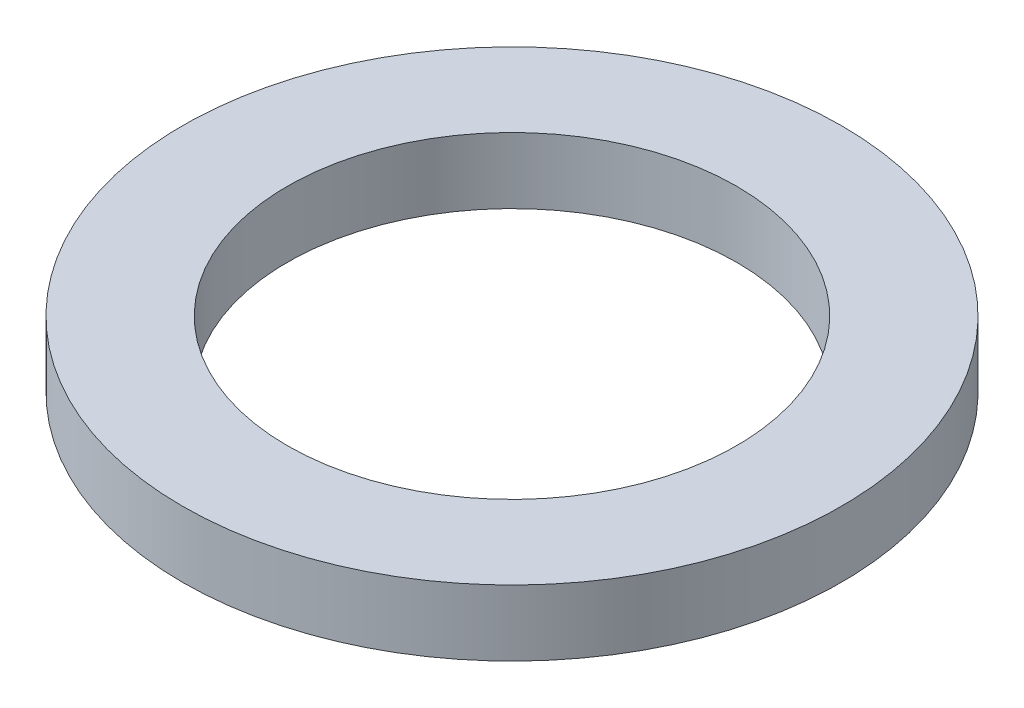
from build123d import *

# Parameters (mm, degrees)
SKETCH1_R           = 55
BOSS_EXTRUDE1_DEPTH = 11
SKETCH2_R           = 37.5
CUT_EXTRUDE1_DEPTH  = 79.555712714


with BuildPart() as part:
    # Sketch1 → Boss-Extrude1 (new body)
    with BuildSketch(Plane(origin=(0, 0, 0), x_dir=(1, 0, 0), z_dir=(0, 1, 0))):
        Circle(SKETCH1_R)
    extrude(amount=BOSS_EXTRUDE1_DEPTH)

    # Sketch2 → Cut-Extrude1 (cut, through all)
    with BuildSketch(Plane(origin=(0, 0, 0), x_dir=(1, 0, 0), z_dir=(0, 1, 0))):
        Circle(SKETCH2_R)
    extrude(amount=CUT_EXTRUDE1_DEPTH, mode=Mode.SUBTRACT)


solid = part.part
